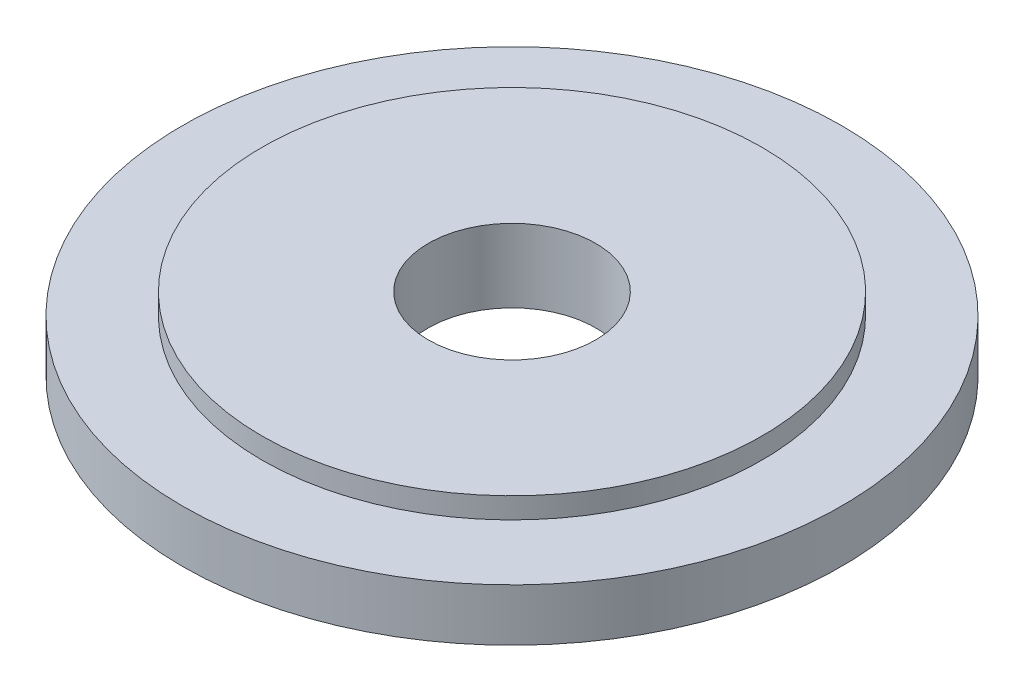
from build123d import *

# Parameters (mm, degrees)
CROQUIS1_R              = 23.9
CROQUIS1_R_2            = 8
SALIENTE_EXTRUIR1_DEPTH = 2
SALIENTE_EXTRUIR2_START = -5
CROQUIS1_3_R            = 31.5
CROQUIS1_3_R_2          = 8
SALIENTE_EXTRUIR2_DEPTH = 5


with BuildPart() as part:
    # Croquis1 → Saliente-Extruir1 (new body)
    with BuildSketch(Plane(origin=(0, 0, 0), x_dir=(1, 0, 0), z_dir=(0, 1, 0))):
        Circle(CROQUIS1_R)
        Circle(CROQUIS1_R_2, mode=Mode.SUBTRACT)
    extrude(amount=SALIENTE_EXTRUIR1_DEPTH)

    # Croquis1<3> → Saliente-Extruir2 (add)
    with BuildSketch(Plane(origin=(0, 0, 0), x_dir=(1, 0, 0), z_dir=(0, 1, 0)).offset(SALIENTE_EXTRUIR2_START)):
        Circle(CROQUIS1_3_R)
        Circle(CROQUIS1_3_R_2, mode=Mode.SUBTRACT)
    extrude(amount=SALIENTE_EXTRUIR2_DEPTH)


solid = part.part
